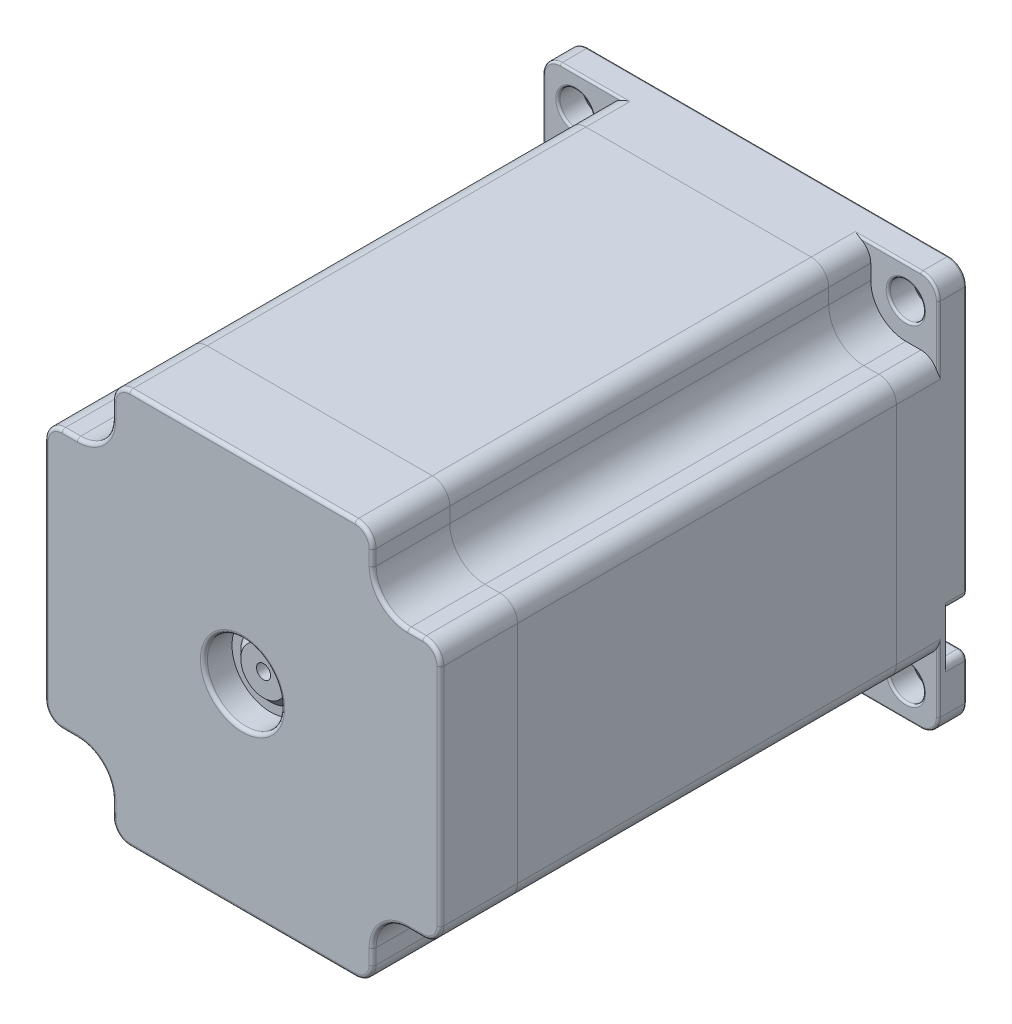
from build123d import *

# Parameters (mm, degrees)
SKETCH_1_W          = 56.4
SKETCH_1_H          = 56.4
EXTRUDE_1_DEPTH     = 10
SKETCH_2_R          = 2.5
CUT_EXTRUDE_1_DEPTH = 42.115447219
CUT_EXTRUDE_2_DEPTH = 6
FILLET_1_R          = 2.5
SKETCH_4_R          = 19.05
EXTRUDE_2_DEPTH     = 1.6
SKETCH_5_R          = 3.175
EXTRUDE_3_DEPTH     = 20.6
CUT_EXTRUDE_START   = -2.5
SKETCH_6_R          = 5.5
SKETCH_6_R_2        = 3.175
CUT_EXTRUDE_3_DEPTH = 2.5
CHAMFER_1_SIZE      = 0.5
SKETCH_7_R          = 1
CUT_EXTRUDE_4_DEPTH = 3
CUT_EXTRUDE_5_DEPTH = 3
FILLET_2_R          = 1
EXTRUDE_5_DEPTH     = 54
EXTRUDE_6_DEPTH     = 11
FILLET_7_R          = 0.5
SKETCH_14_R         = 5.5
CUT_EXTRUDE_8_DEPTH = 4
SKETCH_15_R         = 3.25
EXTRUDE_7_DEPTH     = 1
CUT_EXTRUDE_START_2 = -3
SKETCH_16_R         = 1
CUT_EXTRUDE_9_DEPTH = 3
CHAMFER_3_SIZE      = 1
FILLET_8_R          = 0.5
FILLET_9_R          = 0.3


with BuildPart() as part:
    # Эскиз1 → Бобышка-Вытянуть1 (new body)
    with BuildSketch(Plane.XY):
        Rectangle(SKETCH_1_W, SKETCH_1_H)
    extrude(amount=EXTRUDE_1_DEPTH)

    # Эскиз2 → Вырез-Вытянуть1 (cut, through all)
    with BuildSketch(Plane.XY.offset(10)):
        with Locations((-23.55, 23.55)):
            Circle(SKETCH_2_R)
        with Locations((23.55, 23.55)):
            Circle(SKETCH_2_R)
        with Locations((23.55, -23.55)):
            Circle(SKETCH_2_R)
        with Locations((-23.55, -23.55)):
            Circle(SKETCH_2_R)
    extrude(amount=-CUT_EXTRUDE_1_DEPTH, mode=Mode.SUBTRACT)

    # Эскиз3 → Вырез-Вытянуть2 (cut)
    with BuildSketch(Plane.XY.offset(10)):
        with BuildLine():
            Line((-18.55, 23.55), (-18.55, 28.2))
            Line((-18.55, 28.2), (-28.2, 28.2))
            Line((-28.2, 28.2), (-28.2, 18.55))
            Line((-28.2, 18.55), (-23.55, 18.55))
            ThreePointArc((-23.55, 18.55), (-20.014466094, 20.014466094), (-18.55, 23.55))
        make_face()
        with BuildLine():
            Line((18.55, 23.55), (18.55, 28.2))
            Line((18.55, 28.2), (28.2, 28.2))
            Line((28.2, 28.2), (28.2, 18.55))
            Line((28.2, 18.55), (23.55, 18.55))
            ThreePointArc((23.55, 18.55), (20.014466094, 20.014466094), (18.55, 23.55))
        make_face()
        with BuildLine():
            Line((18.55, -23.55), (18.55, -28.2))
            Line((18.55, -28.2), (28.2, -28.2))
            Line((28.2, -28.2), (28.2, -18.55))
            Line((28.2, -18.55), (23.55, -18.55))
            ThreePointArc((23.55, -18.55), (20.014466094, -20.014466094), (18.55, -23.55))
        make_face()
        with BuildLine():
            Line((-23.55, -18.55), (-28.2, -18.55))
            Line((-28.2, -18.55), (-28.2, -28.2))
            Line((-28.2, -28.2), (-18.55, -28.2))
            Line((-18.55, -28.2), (-18.55, -23.55))
            ThreePointArc((-18.55, -23.55), (-20.014466094, -20.014466094), (-23.55, -18.55))
        make_face()
    extrude(amount=-CUT_EXTRUDE_2_DEPTH, mode=Mode.SUBTRACT)

    # Скругление1
    fillet_1_edges = [part.edges().sort_by_distance(p)[0] for p in [
        (-28.2, 28.2, 2),
        (-28.2, 18.55, 7),
        (-18.55, 28.2, 7),
        (28.2, 28.2, 2),
        (18.55, 28.2, 7),
        (28.2, 18.55, 7),
        (28.2, -28.2, 2),
        (28.2, -18.55, 7),
        (18.55, -28.2, 7),
        (-28.2, -28.2, 2),
        (-18.55, -28.2, 7),
        (-28.2, -18.55, 7),
    ]]
    fillet(fillet_1_edges, radius=FILLET_1_R)

    # Эскиз4 → Бобышка-Вытянуть2 (add)
    with BuildSketch(Plane(origin=(0, 0, 0), x_dir=(-1, 0, 0), z_dir=(0, 0, -1))):
        Circle(SKETCH_4_R)
    extrude(amount=EXTRUDE_2_DEPTH)

    # Эскиз5 → Бобышка-Вытянуть3 (add)
    with BuildSketch(Plane(origin=(0, 0, 0), x_dir=(-1, 0, 0), z_dir=(0, 0, -1))):
        with Locations(Location((0, 0, 0), (0, 0, 180))):
            Circle(SKETCH_5_R)
    extrude(amount=EXTRUDE_3_DEPTH)

    # Эскиз6 → Вырез-Вытянуть3 (cut)
    with BuildSketch(Plane(origin=(0, 0, -1.6), x_dir=(-1, 0, 0), z_dir=(0, 0, -1)).offset(CUT_EXTRUDE_START)):
        Circle(SKETCH_6_R)
        with Locations(Location((0, 0, 0), (0, 0, 180))):
            Circle(SKETCH_6_R_2, mode=Mode.SUBTRACT)
    extrude(amount=CUT_EXTRUDE_3_DEPTH, mode=Mode.SUBTRACT)

    # Фаска1
    chamfer_1_edges = [part.edges().sort_by_distance(p)[0] for p in [
        (-26.05, 23.55, 0),
        (21.05, 23.55, 0),
        (-3.175, 0, -20.6),
        (21.05, -23.55, 0),
        (-26.05, -23.55, 0),
    ]]
    chamfer(chamfer_1_edges, length=CHAMFER_1_SIZE)

    # Эскиз7 → Вырез-Вытянуть4 (cut)
    with BuildSketch(Plane(origin=(0, 0, -20.6), x_dir=(-1, 0, 0), z_dir=(0, 0, -1))):
        Circle(SKETCH_7_R)
    extrude(amount=-CUT_EXTRUDE_4_DEPTH, mode=Mode.SUBTRACT)

    # Эскиз8 → Вырез-Вытянуть5 (cut)
    with BuildSketch(Plane(origin=(0, 0, 0), x_dir=(-1, 0, 0), z_dir=(0, 0, -1))):
        with BuildLine():
            Line((-28.2, -12.95), (-25.45, -12.95))
            ThreePointArc((-25.45, -12.95), (-22.2, -16.2), (-25.45, -19.45))
            Line((-25.45, -19.45), (-28.2, -19.45))
            ThreePointArc((-28.2, -19.45), (-31.45, -16.2), (-28.2, -12.95))
        make_face()
    extrude(amount=-CUT_EXTRUDE_5_DEPTH, mode=Mode.SUBTRACT)

    # Скругление2
    fillet_2_edges = [part.edges().sort_by_distance(p)[0] for p in [
        (28.2, -19.45, 1.5),
        (28.2, -12.95, 1.5),
    ]]
    fillet(fillet_2_edges, radius=FILLET_2_R)

    # Скругление9
    fillet_9_edges = [part.edges().sort_by_distance(p)[0] for p in [
        (28.2, -20.875, 4),
        (28.2, -23.075, 0),
        (0, -28.2, 0),
        (-28.2, 0, 0),
        (0, 28.2, 0),
        (27.467766953, 27.467766953, 0),
        (-27.467766953, 27.467766953, 0),
        (-27.467766953, -27.467766953, 0),
        (27.467766953, -27.467766953, 0),
        (-20.875, -28.2, 4),
        (27.467766953, -27.467766953, 4),
        (-28.2, 20.875, 4),
        (-27.467766953, -27.467766953, 4),
        (20.875, 28.2, 4),
        (-27.467766953, 27.467766953, 4),
        (27.467766953, 27.467766953, 4),
        (19.05, 0, 0),
        (19.05, 0, -1.6),
        (5.5, 0, -1.6),
        (26.325, -12.95, 0),
        (22.2, -16.2, 0),
        (26.325, -19.45, 0),
        (28.2, 6.875, 0),
        (27.907106781, -12.657106781, 0),
        (27.907106781, -19.742893219, 0),
        (-20.875, 28.2, 4),
        (-26.05, 23.55, 4),
        (28.2, 20.875, 4),
        (21.05, 23.55, 4),
        (20.875, -28.2, 4),
        (21.05, -23.55, 4),
        (-28.2, -20.875, 4),
        (-26.05, -23.55, 4),
    ]]
    fillet(fillet_9_edges, radius=FILLET_9_R)


with BuildPart() as body_2:
    # Эскиз11 → Бобышка-Вытянуть5 (new body)
    with BuildSketch(Plane.XY.offset(10)):
        with BuildLine():
            Line((23.55, -18.55), (25.7, -18.55))
            ThreePointArc((25.7, -18.55), (27.467766953, -17.817766953), (28.2, -16.05))
            Line((28.2, -16.05), (28.2, 16.05))
            ThreePointArc((28.2, 16.05), (27.467766953, 17.817766953), (25.7, 18.55))
            Line((25.7, 18.55), (23.55, 18.55))
            ThreePointArc((23.55, 18.55), (20.014466094, 20.014466094), (18.55, 23.55))
            Line((18.55, 23.55), (18.55, 25.7))
            ThreePointArc((18.55, 25.7), (17.817766953, 27.467766953), (16.05, 28.2))
            Line((16.05, 28.2), (-16.05, 28.2))
            ThreePointArc((-16.05, 28.2), (-17.817766953, 27.467766953), (-18.55, 25.7))
            Line((-18.55, 25.7), (-18.55, 23.55))
            ThreePointArc((-18.55, 23.55), (-20.014466094, 20.014466094), (-23.55, 18.55))
            Line((-23.55, 18.55), (-25.7, 18.55))
            ThreePointArc((-25.7, 18.55), (-27.467766953, 17.817766953), (-28.2, 16.05))
            Line((-28.2, 16.05), (-28.2, -16.05))
            ThreePointArc((-28.2, -16.05), (-27.467766953, -17.817766953), (-25.7, -18.55))
            Line((-25.7, -18.55), (-23.55, -18.55))
            ThreePointArc((-23.55, -18.55), (-20.014466094, -20.014466094), (-18.55, -23.55))
            Line((-18.55, -23.55), (-18.55, -25.7))
            ThreePointArc((-18.55, -25.7), (-17.817766953, -27.467766953), (-16.05, -28.2))
            Line((-16.05, -28.2), (16.05, -28.2))
            ThreePointArc((16.05, -28.2), (17.817766953, -27.467766953), (18.55, -25.7))
            Line((18.55, -25.7), (18.55, -23.55))
            ThreePointArc((18.55, -23.55), (20.014466094, -20.014466094), (23.55, -18.55))
        make_face()
    extrude(amount=EXTRUDE_5_DEPTH)


with BuildPart() as body_3:
    # Эскиз12 → Бобышка-Вытянуть6 (new body)
    with BuildSketch(Plane.XY.offset(64)):
        with BuildLine():
            Line((23.55, -18.55), (25.7, -18.55))
            ThreePointArc((25.7, -18.55), (27.467766953, -17.817766953), (28.2, -16.05))
            Line((28.2, -16.05), (28.2, 16.05))
            ThreePointArc((28.2, 16.05), (27.467766953, 17.817766953), (25.7, 18.55))
            Line((25.7, 18.55), (23.55, 18.55))
            ThreePointArc((23.55, 18.55), (20.014466094, 20.014466094), (18.55, 23.55))
            Line((18.55, 23.55), (18.55, 25.7))
            ThreePointArc((18.55, 25.7), (17.817766953, 27.467766953), (16.05, 28.2))
            Line((16.05, 28.2), (-16.05, 28.2))
            ThreePointArc((-16.05, 28.2), (-17.817766953, 27.467766953), (-18.55, 25.7))
            Line((-18.55, 25.7), (-18.55, 23.55))
            ThreePointArc((-18.55, 23.55), (-20.014466094, 20.014466094), (-23.55, 18.55))
            Line((-23.55, 18.55), (-25.7, 18.55))
            ThreePointArc((-25.7, 18.55), (-27.467766953, 17.817766953), (-28.2, 16.05))
            Line((-28.2, 16.05), (-28.2, -16.05))
            ThreePointArc((-28.2, -16.05), (-27.467766953, -17.817766953), (-25.7, -18.55))
            Line((-25.7, -18.55), (-23.55, -18.55))
            ThreePointArc((-23.55, -18.55), (-20.014466094, -20.014466094), (-18.55, -23.55))
            Line((-18.55, -23.55), (-18.55, -25.7))
            ThreePointArc((-18.55, -25.7), (-17.817766953, -27.467766953), (-16.05, -28.2))
            Line((-16.05, -28.2), (16.05, -28.2))
            ThreePointArc((16.05, -28.2), (17.817766953, -27.467766953), (18.55, -25.7))
            Line((18.55, -25.7), (18.55, -23.55))
            ThreePointArc((18.55, -23.55), (20.014466094, -20.014466094), (23.55, -18.55))
        make_face()
    extrude(amount=EXTRUDE_6_DEPTH)

    # Скругление7
    fillet_7_edges = [body_3.edges().sort_by_distance(p)[0] for p in [
        (27.467766953, -17.817766953, 75),
        (28.2, 0, 75),
        (27.467766953, 17.817766953, 75),
        (24.625, 18.55, 75),
        (20.014466094, 20.014466094, 75),
        (18.55, 24.625, 75),
        (17.817766953, 27.467766953, 75),
        (0, 28.2, 75),
        (-17.817766953, 27.467766953, 75),
        (-18.55, 24.625, 75),
        (20.014466094, -20.014466094, 75),
        (-20.014466094, 20.014466094, 75),
        (-24.625, 18.55, 75),
        (-27.467766953, 17.817766953, 75),
        (-28.2, 0, 75),
        (-27.467766953, -17.817766953, 75),
        (-24.625, -18.55, 75),
        (-20.014466094, -20.014466094, 75),
        (-18.55, -24.625, 75),
        (-17.817766953, -27.467766953, 75),
        (0, -28.2, 75),
        (24.625, -18.55, 75),
        (17.817766953, -27.467766953, 75),
        (18.55, -24.625, 75),
    ]]
    fillet(fillet_7_edges, radius=FILLET_7_R)

    # Эскиз14 → Вырез-Вытянуть8 (cut)
    with BuildSketch(Plane.XY.offset(75)):
        Circle(SKETCH_14_R)
    extrude(amount=-CUT_EXTRUDE_8_DEPTH, mode=Mode.SUBTRACT)

    # Эскиз15 → Бобышка-Вытянуть7 (add)
    with BuildSketch(Plane.XY.offset(71)):
        Circle(SKETCH_15_R)
    extrude(amount=EXTRUDE_7_DEPTH)

    # Эскиз16 → Вырез-Вытянуть9 (cut)
    with BuildSketch(Plane.XY.offset(72).offset(CUT_EXTRUDE_START_2)):
        Circle(SKETCH_16_R)
    extrude(amount=CUT_EXTRUDE_9_DEPTH, mode=Mode.SUBTRACT)

    # Фаска3
    chamfer_3_edges = [body_3.edges().sort_by_distance(p)[0] for p in [
        (-3.25, 0, 71),
    ]]
    chamfer(chamfer_3_edges, length=CHAMFER_3_SIZE - 0.0001)  # a hair under: the kernel refuses the full size

    # Скругление8
    fillet_8_edges = [body_3.edges().sort_by_distance(p)[0] for p in [
        (-5.5, 0, 75),
    ]]
    fillet(fillet_8_edges, radius=FILLET_8_R)


solid = Compound([part.part, body_2.part, body_3.part])
